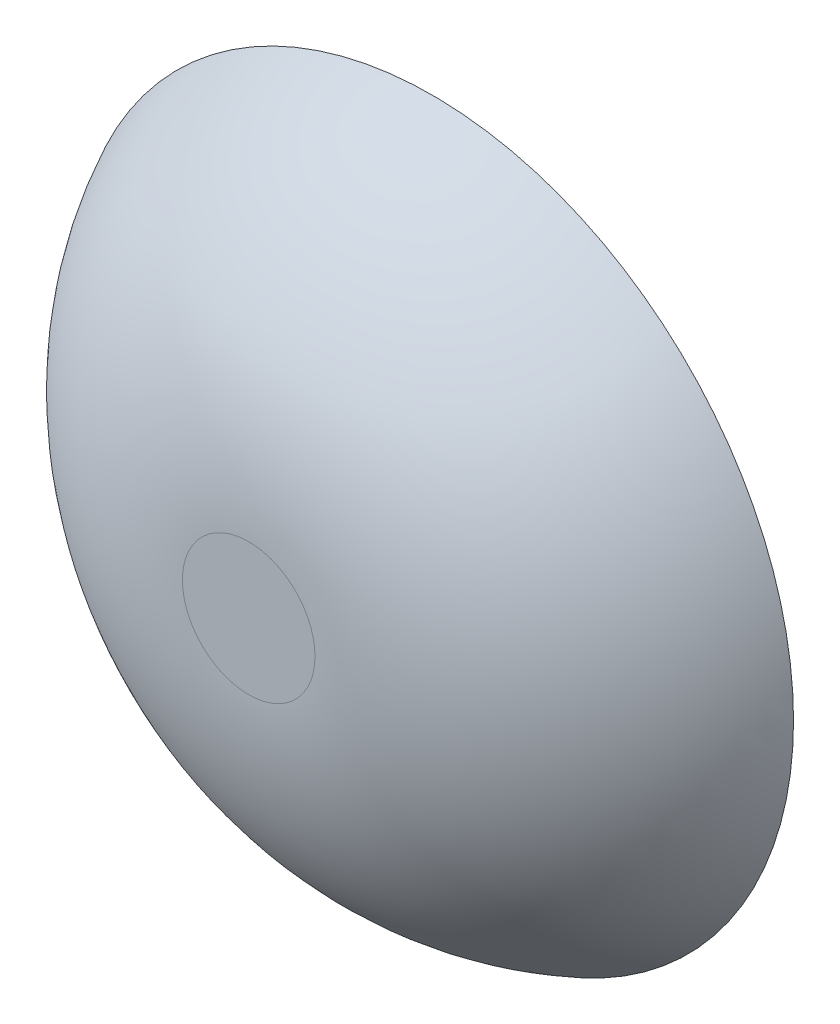
from build123d import *

# Parameters (mm, degrees)
ESQUISSE1_R      = 5.5
EXTRUSION1_DEPTH = 2.8
CONG_1_R         = 5


with BuildPart() as part:
    # Esquisse1 → Extrusion1 (new body)
    with BuildSketch(Plane.XY):
        Circle(ESQUISSE1_R)
    extrude(amount=EXTRUSION1_DEPTH)

    # Congé1
    # the kernel refuses this fillet: 5 mm, written as the material it takes off along each edge
    with BuildSketch(Plane(origin=(0, 0, 2.8), x_dir=(1, 0, 0), z_dir=(0, -1, 0))) as cong_1_piece_1:
        with BuildLine():
            CenterArc((1.010011136, -5), CONG_1_R, 26.103881137, 63.896118863)
            Line((1.010011136, 0), (1.010011136, 0.1))
            Line((1.010011136, 0.1), (5.5, 0.1))
            Line((5.5, 0.1), (5.6, 0))
            ThreePointArc((5.6, 0), (5.6, -1.4), (5.589799777, -2.756))
            Line((5.589799777, -2.756), (5.5, -2.8))
        make_face()
    revolve(axis=Axis((0, 0, 2.8), (0, 0, 1)), mode=Mode.SUBTRACT)


solid = part.part
